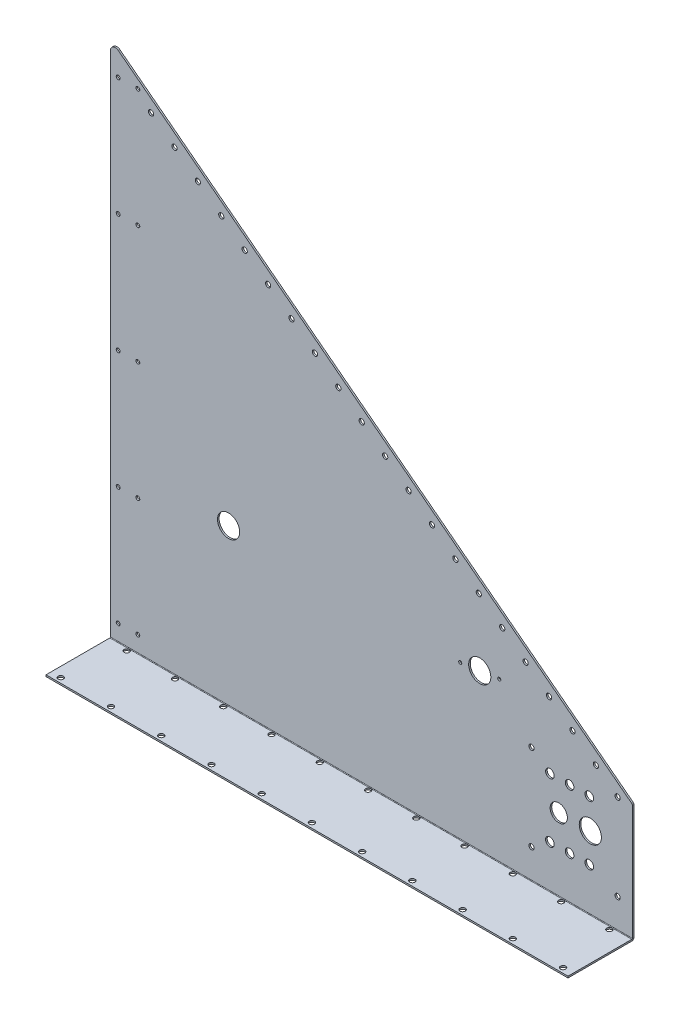
from build123d import *

# Parameters (mm, degrees)
BASE_FLANGE1_DEPTH           = 2.05232
EDGE_FLANGE1_STRIP_W         = 9.68248
EDGE_FLANGE1_STRIP_H         = 2.05232
EDGE_FLANGE1_STRIP_CUT_DEPTH = 673.1
EDGE_FLANGE1_DEPTH           = 673.1
SKETCH9_R                    = 3.3782
CUT_EXTRUDE1_DEPTH           = 2.54
SKETCH11_R                   = 2.5
CUT_EXTRUDE2_DEPTH           = 2.54
SKETCH12_R                   = 3.3782
SKETCH12_R_2                 = 14.2875
SKETCH12_R_3                 = 2.0193
CUT_EXTRUDE3_DEPTH           = 2.54
FILLET1_R                    = 2.54
SKETCH13_R                   = 5.5626
SKETCH13_R_2                 = 11.1125
SKETCH13_R_3                 = 14.2875
CUT_EXTRUDE4_DEPTH           = 2.54
SKETCH14_R                   = 3.3782
CUT_EXTRUDE5_DEPTH           = 2.54


# Sheet-metal steps are written as plain solids
with BuildPart() as part:
    # Sketch1 → Base-Flange1 (new body)
    with BuildSketch(Plane.XY):
        with BuildLine():
            Line((-279.272286306, -371.833913043), (-279.272286306, 285.935830835))
            ThreePointArc((-279.272286306, 285.935830835), (-275.352326101, 291.802465867), (-268.432158245, 290.425958896))
            Line((-268.432158245, 290.425958896), (393.827713694, -219.433913043))
            Line((393.827713694, -219.433913043), (393.827713694, -371.833913043))
            Line((393.827713694, -371.833913043), (-279.272286306, -371.833913043))
        make_face()
    extrude(amount=-BASE_FLANGE1_DEPTH)

    # Edge-Flange1 strip (across the edge) → Edge-Flange1 strip cut (cut)
    with BuildSketch(Plane(origin=(-279.272286306, -371.833913043, 0), x_dir=(0, 1, 0), z_dir=(1, 0, 0))):
        with Locations((-2.05232, -1.02616)):
            Rectangle(EDGE_FLANGE1_STRIP_W, EDGE_FLANGE1_STRIP_H)
    extrude(amount=EDGE_FLANGE1_STRIP_CUT_DEPTH, mode=Mode.SUBTRACT)

    # Edge-Flange1 section (across the edge) → Edge-Flange1 (add)
    with BuildSketch(Plane(origin=(-279.272286306, -371.833913043, 0), x_dir=(0, 1, 0), z_dir=(1, 0, 0))):
        with BuildLine():
            Line((0, 0.7366), (0, 83.03768))
            Line((0, 83.03768), (2.05232, 83.03768))
            Line((2.05232, 83.03768), (2.05232, 0.7366))
            ThreePointArc((2.05232, 0.7366), (2.268065145, 0.215745145), (2.78892, 0))
            Line((2.78892, 0), (2.78892, -2.05232))
            ThreePointArc((2.78892, -2.05232), (0.816855756, -1.235464244), (0, 0.7366))
        make_face()
    extrude(amount=EDGE_FLANGE1_DEPTH)

    # Sketch9 → Cut-Extrude1 (cut)
    with BuildSketch(Plane(origin=(0, -369.781593043, 0), x_dir=(1, 0, 0), z_dir=(0, 1, 0))):
        with Locations(Location((381.127713694, -76.68768, 0), (0, 0, 270))):
            Circle(SKETCH9_R)
        with Locations(Location((316.357713694, -76.68768, 0), (0, 0, 270))):
            Circle(SKETCH9_R)
        with Locations(Location((251.587713694, -76.68768, 0), (0, 0, 270))):
            Circle(SKETCH9_R)
        with Locations(Location((186.817713694, -76.68768, 0), (0, 0, 270))):
            Circle(SKETCH9_R)
        with Locations(Location((122.047713694, -76.68768, 0), (0, 0, 270))):
            Circle(SKETCH9_R)
        with Locations(Location((57.277713694, -76.68768, 0), (0, 0, 270))):
            Circle(SKETCH9_R)
        with Locations(Location((-7.492286306, -76.68768, 0), (0, 0, 270))):
            Circle(SKETCH9_R)
        with Locations(Location((-72.262286306, -76.68768, 0), (0, 0, 270))):
            Circle(SKETCH9_R)
        with Locations(Location((-137.032286306, -76.68768, 0), (0, 0, 270))):
            Circle(SKETCH9_R)
        with Locations(Location((-201.802286306, -76.68768, 0), (0, 0, 270))):
            Circle(SKETCH9_R)
        with Locations(Location((-266.572286306, -76.68768, 0), (0, 0, 270))):
            Circle(SKETCH9_R)
        with Locations(Location((368.427713694, -4.29768, 0), (0, 0, 270))):
            Circle(SKETCH9_R)
        with Locations(Location((306.197713694, -4.29768, 0), (0, 0, 270))):
            Circle(SKETCH9_R)
        with Locations(Location((243.967713694, -4.29768, 0), (0, 0, 270))):
            Circle(SKETCH9_R)
        with Locations(Location((181.737713694, -4.29768, 0), (0, 0, 270))):
            Circle(SKETCH9_R)
        with Locations(Location((119.507713694, -4.29768, 0), (0, 0, 270))):
            Circle(SKETCH9_R)
        with Locations(Location((57.277713694, -4.29768, 0), (0, 0, 270))):
            Circle(SKETCH9_R)
        with Locations(Location((-4.952286306, -4.29768, 0), (0, 0, 270))):
            Circle(SKETCH9_R)
        with Locations(Location((-67.182286306, -4.29768, 0), (0, 0, 270))):
            Circle(SKETCH9_R)
        with Locations(Location((-129.412286306, -4.29768, 0), (0, 0, 270))):
            Circle(SKETCH9_R)
        with Locations(Location((-191.642286306, -4.29768, 0), (0, 0, 270))):
            Circle(SKETCH9_R)
        with Locations(Location((-253.872286306, -4.29768, 0), (0, 0, 270))):
            Circle(SKETCH9_R)
    extrude(amount=-CUT_EXTRUDE1_DEPTH, mode=Mode.SUBTRACT)

    # Sketch11 → Cut-Extrude2 (cut)
    with BuildSketch(Plane.XY):
        with Locations((-269.272286306, 260.799452815)):
            Circle(SKETCH11_R)
        with Locations((-269.272286306, 108.399452815)):
            Circle(SKETCH11_R)
        with Locations((-269.272286306, -44.000547185)):
            Circle(SKETCH11_R)
        with Locations((-269.272286306, -196.400547185)):
            Circle(SKETCH11_R)
        with Locations((-269.272286306, -348.800547185)):
            Circle(SKETCH11_R)
        with Locations((-243.872286306, 260.799452815)):
            Circle(SKETCH11_R)
        with Locations((-243.872286306, 108.399452815)):
            Circle(SKETCH11_R)
        with Locations((-243.872286306, -44.000547185)):
            Circle(SKETCH11_R)
        with Locations((-243.872286306, -196.400547185)):
            Circle(SKETCH11_R)
        with Locations((-243.872286306, -348.800547185)):
            Circle(SKETCH11_R)
    extrude(amount=-CUT_EXTRUDE2_DEPTH, mode=Mode.SUBTRACT)

    # Sketch12 → Cut-Extrude3 (cut)
    with BuildSketch(Plane(origin=(0, 0, -2.05232), x_dir=(-1, 0, 0), z_dir=(0, 0, -1))):
        with Locations((-374.777713694, -220.79547031)):
            Circle(SKETCH12_R)
        with Locations((-374.777713694, -331.92047031)):
            Circle(SKETCH12_R)
        with Locations((-263.652713694, -331.92047031)):
            Circle(SKETCH12_R)
        with Locations((-263.652713694, -220.79547031)):
            Circle(SKETCH12_R)
        with Locations((-196.977713694, -168.633913043)):
            Circle(SKETCH12_R_2)
        with Locations((126.872286306, -168.633913043)):
            Circle(SKETCH12_R_2)
        with Locations((-222.165699247, -165.358949868)):
            Circle(SKETCH12_R_3)
        with Locations((-171.789728141, -171.908876219)):
            Circle(SKETCH12_R_3)
    extrude(amount=-CUT_EXTRUDE3_DEPTH, mode=Mode.SUBTRACT)

    # Fillet1
    fillet1_edges = [part.edges().sort_by_distance(p)[0] for p in [
        (393.827713694, -219.433913043, -1.02616),
    ]]
    fillet(fillet1_edges, radius=FILLET1_R)

    # Sketch13 → Cut-Extrude4 (cut)
    with BuildSketch(Plane(origin=(0, 0, -2.05232), x_dir=(-1, 0, 0), z_dir=(0, 0, -1))):
        with Locations((-287.465213694, -314.566215277)):
            Circle(SKETCH13_R)
        with Locations((-312.865213694, -314.566215277)):
            Circle(SKETCH13_R)
        with Locations((-338.265213694, -314.566215277)):
            Circle(SKETCH13_R)
        with Locations((-298.869813694, -276.35797031)):
            Circle(SKETCH13_R_2)
        with Locations((-339.560613694, -276.35797031)):
            Circle(SKETCH13_R_3)
        with Locations((-287.465213694, -238.149725343)):
            Circle(SKETCH13_R)
        with Locations((-312.865213694, -238.149725343)):
            Circle(SKETCH13_R)
        with Locations((-338.265213694, -238.149725343)):
            Circle(SKETCH13_R)
    extrude(amount=-CUT_EXTRUDE4_DEPTH, mode=Mode.SUBTRACT)

    # Sketch14 → Cut-Extrude5 (cut)
    with BuildSketch(Plane.XY):
        with Locations((-226.880308275, 242.408318762)):
            Circle(SKETCH14_R)
        with Locations((-196.690792188, 219.166048683)):
            Circle(SKETCH14_R)
        with Locations((-166.501276101, 195.923778604)):
            Circle(SKETCH14_R)
        with Locations((-136.311760014, 172.681508525)):
            Circle(SKETCH14_R)
        with Locations((-106.122243926, 149.439238446)):
            Circle(SKETCH14_R)
        with Locations((-75.932727839, 126.196968367)):
            Circle(SKETCH14_R)
        with Locations((-45.743211752, 102.954698288)):
            Circle(SKETCH14_R)
        with Locations((-15.553695665, 79.712428209)):
            Circle(SKETCH14_R)
        with Locations((14.635820422, 56.47015813)):
            Circle(SKETCH14_R)
        with Locations((44.825336509, 33.227888051)):
            Circle(SKETCH14_R)
        with Locations((75.014852596, 9.985617972)):
            Circle(SKETCH14_R)
        with Locations((105.204368683, -13.256652107)):
            Circle(SKETCH14_R)
        with Locations((135.393884771, -36.498922186)):
            Circle(SKETCH14_R)
        with Locations((165.583400858, -59.741192265)):
            Circle(SKETCH14_R)
        with Locations((195.772916945, -82.983462344)):
            Circle(SKETCH14_R)
        with Locations((225.962433032, -106.225732423)):
            Circle(SKETCH14_R)
        with Locations((256.151949119, -129.468002502)):
            Circle(SKETCH14_R)
        with Locations((286.341465206, -152.710272581)):
            Circle(SKETCH14_R)
        with Locations((316.530981293, -175.95254266)):
            Circle(SKETCH14_R)
        with Locations((346.720497381, -199.194812739)):
            Circle(SKETCH14_R)
    extrude(amount=-CUT_EXTRUDE5_DEPTH, mode=Mode.SUBTRACT)


solid = part.part
